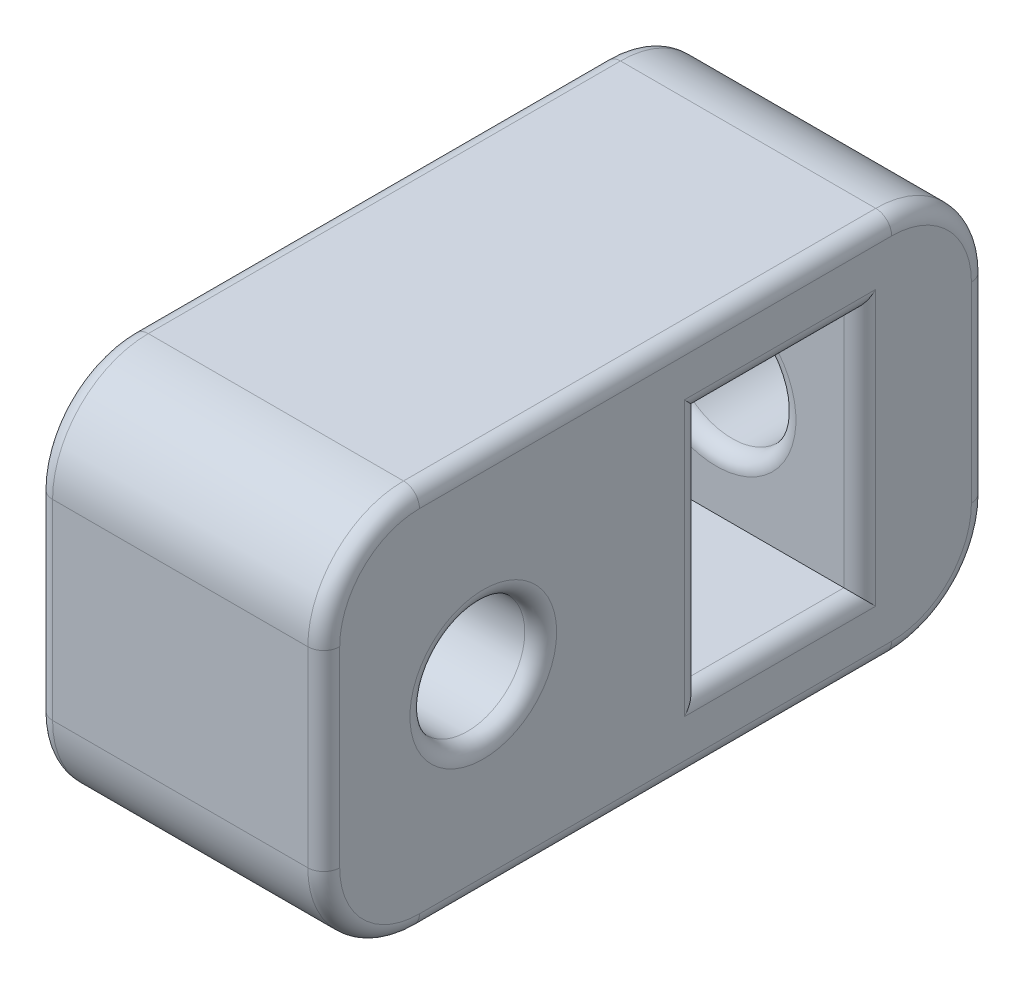
from build123d import *

# Parameters (mm, degrees)
SKETCH1_W           = 26.416
SKETCH1_H           = 15.24
SKETCH1_R           = 2.286
BOSS_EXTRUDE1_DEPTH = 5.715
SKETCH2_R           = 2.54
CUT_EXTRUDE1_DEPTH  = 12.7
FILLET1_R           = 3.81
SKETCH3_W           = 6.35
SKETCH3_H           = 9.652
CUT_EXTRUDE2_DEPTH  = 25.317764206
FILLET2_R           = 0.635
FILLET3_R           = 0.635


with BuildPart() as part:
    # Sketch1 → Boss-Extrude1 (new, symmetric)
    with BuildSketch(Plane(origin=(0, 0, 0), x_dir=(0, 0, -1), z_dir=(1, 0, 0))):
        with Locations((6.858, 0)):
            Rectangle(SKETCH1_W, SKETCH1_H)
        Circle(SKETCH1_R, mode=Mode.SUBTRACT)
    extrude(amount=BOSS_EXTRUDE1_DEPTH, both=True)

    # Sketch2 → Cut-Extrude1 (cut)
    with BuildSketch(Plane(origin=(0, 0, -20.066), x_dir=(-1, 0, 0), z_dir=(0, 0, -1))):
        with Locations(Location((0, 0, 0), (0, 0, 90))):
            Circle(SKETCH2_R)
    extrude(amount=-CUT_EXTRUDE1_DEPTH, mode=Mode.SUBTRACT)

    # Fillet1
    fillet1_edges = [part.edges().sort_by_distance(p)[0] for p in [
        (0, 7.62, 6.35),
        (0, 7.62, -20.066),
        (0, -7.62, -20.066),
        (0, -7.62, 6.35),
    ]]
    fillet(fillet1_edges, radius=FILLET1_R)

    # Sketch3 → Cut-Extrude2 (cut, through all)
    with BuildSketch(Plane(origin=(5.715, 0, 0), x_dir=(0, 0, -1), z_dir=(1, 0, 0))):
        with Locations((11.811, 0)):
            Rectangle(SKETCH3_W, SKETCH3_H)
    extrude(amount=-CUT_EXTRUDE2_DEPTH, mode=Mode.SUBTRACT)

    # Fillet2
    fillet2_edges = [part.edges().sort_by_distance(p)[0] for p in [
        (-5.715, 0, 2.286),
        (5.715, 0, 2.286),
        (-5.715, 0, -20.066),
        (5.715, 0, -20.066),
        (-5.715, 0, 6.35),
        (-5.715, 7.62, -6.858),
        (-5.715, -7.62, -6.858),
        (-5.715, -6.504076836, 5.234076836),
        (-5.715, 6.504076836, 5.234076836),
        (-5.715, 6.504076836, -18.950076836),
        (-5.715, -6.504076836, -18.950076836),
        (5.715, -7.62, -6.858),
        (5.715, 0, 6.35),
        (5.715, 7.62, -6.858),
        (5.715, -6.504076836, 5.234076836),
        (5.715, 6.504076836, 5.234076836),
        (5.715, 6.504076836, -18.950076836),
        (5.715, -6.504076836, -18.950076836),
        (-5.715, 0, -8.636),
        (-5.715, 0, -14.986),
        (-5.715, 4.826, -11.811),
        (-5.715, -4.826, -11.811),
        (5.715, 0, -8.636),
        (5.715, -4.826, -11.811),
        (5.715, 0, -14.986),
        (5.715, 4.826, -11.811),
    ]]
    fillet(fillet2_edges, radius=FILLET2_R)

    # Fillet3
    fillet3_edges = [part.edges().sort_by_distance(p)[0] for p in [
        (0, -2.54, -7.366),
        (0, -2.54, -20.066),
        (0, -2.54, -8.636),
        (0, -2.54, -14.986),
    ]]
    fillet(fillet3_edges, radius=FILLET3_R - 0.0001)  # a hair under: the kernel refuses the full size


solid = part.part
